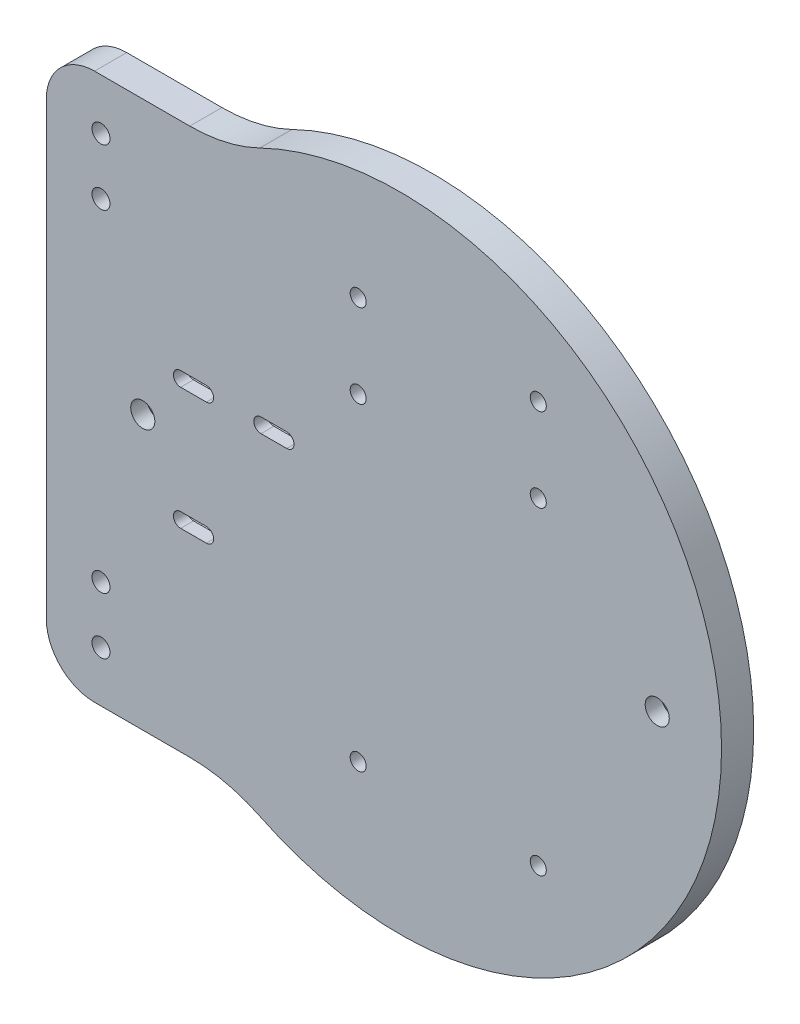
from build123d import *

# Parameters (mm, degrees)
SALIENTE_EXTRUIR2_DEPTH                              = 10
REDONDEO3_R                                          = 15
REDONDEO5_R                                          = 50
CROQUIS4_R                                           = 2.8
CROQUIS4_R_2                                         = 2.5
CORTAR_EXTRUIR1_DEPTH                                = 149.996644258
REFRENTADO_PARA_TORNILLO_CON_CABEZA_TRON_D           = 4.5
REFRENTADO_PARA_TORNILLO_CON_CABEZA_TRON_CBORE_D     = 7.5
REFRENTADO_PARA_TORNILLO_CON_CABEZA_TRON_CBORE_DEPTH = 5
CORTAR_EXTRUIR2_DEPTH                                = 6


with BuildPart() as part:
    # Croquis2 → Saliente-Extruir2 (new body)
    with BuildSketch(Plane(origin=(0, 0, 0), x_dir=(0, 1, 0), z_dir=(0, 0, 1))):
        with BuildLine():
            Line((-85, 52.678268764), (-85, 110))
            Line((-85, 110), (85, 110))
            Line((85, 110), (85, 52.678268764))
            ThreePointArc((85, 52.678268764), (0, -100), (-85, 52.678268764))
        make_face()
    extrude(amount=SALIENTE_EXTRUIR2_DEPTH)

    # Redondeo3
    redondeo3_edges = [part.edges().sort_by_distance(p)[0] for p in [
        (-110, 85, 5),
        (-110, -85, 5),
    ]]
    fillet(redondeo3_edges, radius=REDONDEO3_R)

    # Redondeo5
    redondeo5_edges = [part.edges().sort_by_distance(p)[0] for p in [
        (-52.678268764, 85, 5),
        (-52.678268764, -85, 5),
    ]]
    fillet(redondeo5_edges, radius=REDONDEO5_R)

    # Croquis4 → Cortar-Extruir1 (cut, through all)
    with BuildSketch(Plane.XY.offset(10)):
        with Locations((-93, 69.2)):
            Circle(CROQUIS4_R)
        with Locations((-93, 51.594449783)):
            Circle(CROQUIS4_R)
        with Locations((-93, -51.594449783)):
            Circle(CROQUIS4_R)
        with Locations((-93, -69.2)):
            Circle(CROQUIS4_R)
        with Locations((-13, 39)):
            Circle(CROQUIS4_R_2)
        with Locations((43, 39)):
            Circle(CROQUIS4_R_2)
        with Locations((-13, 65)):
            Circle(CROQUIS4_R_2)
        with Locations((43, 65)):
            Circle(CROQUIS4_R_2)
        with Locations((-13, -60)):
            Circle(CROQUIS4_R_2)
        with Locations((43, -60)):
            Circle(CROQUIS4_R_2)
        with BuildLine():
            Line((-60.219532094, 13.25), (-68.219532094, 13.25))
            ThreePointArc((-68.219532094, 13.25), (-70.469532094, 15.5), (-68.219532094, 17.75))
            Line((-68.219532094, 17.75), (-60.219532094, 17.75))
            ThreePointArc((-60.219532094, 17.75), (-57.969532094, 15.5), (-60.219532094, 13.25))
        make_face()
        with BuildLine():
            Line((-35.219532094, 13.25), (-43.219532094, 13.25))
            ThreePointArc((-43.219532094, 13.25), (-45.469532094, 15.5), (-43.219532094, 17.75))
            Line((-43.219532094, 17.75), (-35.219532094, 17.75))
            ThreePointArc((-35.219532094, 17.75), (-32.969532094, 15.5), (-35.219532094, 13.25))
        make_face()
        with BuildLine():
            Line((-60.219532094, -24.75), (-68.219532094, -24.75))
            ThreePointArc((-68.219532094, -24.75), (-70.469532094, -22.5), (-68.219532094, -20.25))
            Line((-68.219532094, -20.25), (-60.219532094, -20.25))
            ThreePointArc((-60.219532094, -20.25), (-57.969532094, -22.5), (-60.219532094, -24.75))
        make_face()
    extrude(amount=-CORTAR_EXTRUIR1_DEPTH, mode=Mode.SUBTRACT)

    # Refrentado para tornillo con cabeza troncocónica de M41 (through all)
    with Locations(Plane.XY.offset(10)):
        with Locations((-80, 0), (80, 0)):
            CounterBoreHole(REFRENTADO_PARA_TORNILLO_CON_CABEZA_TRON_D / 2, REFRENTADO_PARA_TORNILLO_CON_CABEZA_TRON_CBORE_D / 2, REFRENTADO_PARA_TORNILLO_CON_CABEZA_TRON_CBORE_DEPTH)

    # Croquis7 → Cortar-Extruir2 (cut)
    with BuildSketch(Plane(origin=(0, 0, 0), x_dir=(1, 0, 0), z_dir=(0, 0, -1))):
        with BuildLine():
            Line((-68.219532094, 27), (-60.219532094, 27))
            ThreePointArc((-60.219532094, 27), (-55.719532094, 22.5), (-60.219532094, 18))
            Line((-60.219532094, 18), (-68.219532094, 18))
            ThreePointArc((-68.219532094, 18), (-72.719532094, 22.5), (-68.219532094, 27))
        make_face()
        with BuildLine():
            Line((-68.219532094, -11), (-60.219532094, -11))
            ThreePointArc((-60.219532094, -11), (-55.719532094, -15.5), (-60.219532094, -20))
            Line((-60.219532094, -20), (-68.219532094, -20))
            ThreePointArc((-68.219532094, -20), (-72.719532094, -15.5), (-68.219532094, -11))
        make_face()
        with BuildLine():
            Line((-43.219532094, -11), (-35.219532094, -11))
            ThreePointArc((-35.219532094, -11), (-30.719532094, -15.5), (-35.219532094, -20))
            Line((-35.219532094, -20), (-43.219532094, -20))
            ThreePointArc((-43.219532094, -20), (-47.719532094, -15.5), (-43.219532094, -11))
        make_face()
    extrude(amount=-CORTAR_EXTRUIR2_DEPTH, mode=Mode.SUBTRACT)


solid = part.part
